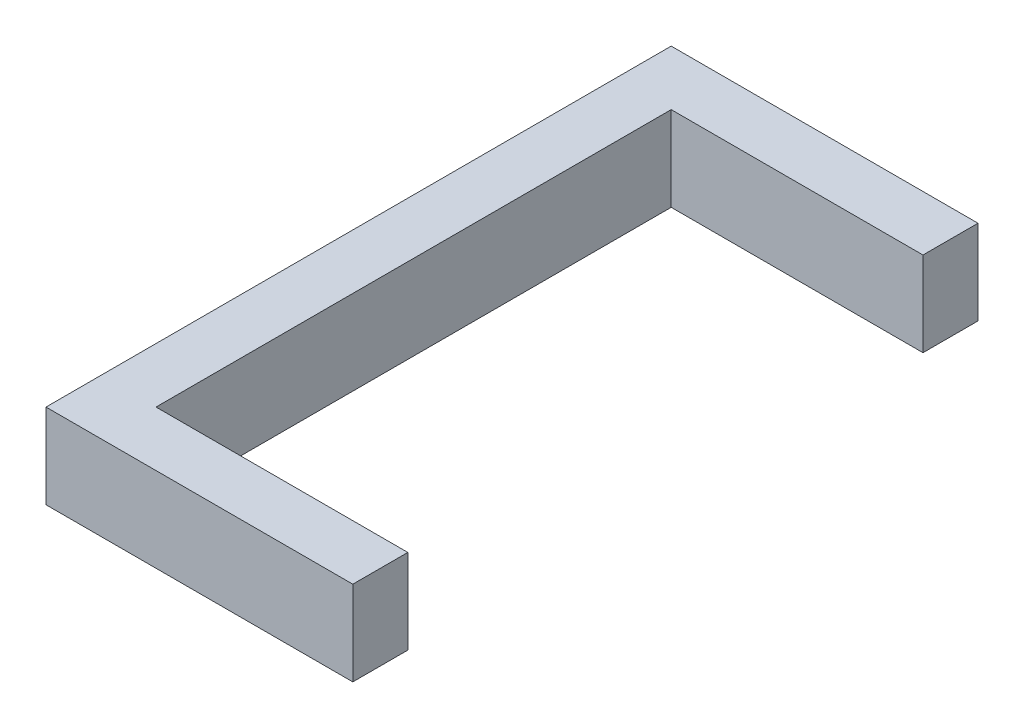
from build123d import *

# Parameters (mm, degrees)
BOSS_EXTRUDE1_DEPTH = 127


with BuildPart() as part:
    # Sketch1 → Boss-Extrude1 (new body)
    with BuildSketch(Plane(origin=(0, 0, 0), x_dir=(1, 0, 0), z_dir=(0, 1, 0))):
        Polygon((0, 0), (0, 938.149), (460.375, 938.149), (460.375, 855.599), (82.55, 855.599), (82.55, 82.55), (460.375, 82.55), (460.375, 0), align=None)
    extrude(amount=BOSS_EXTRUDE1_DEPTH)


solid = part.part
